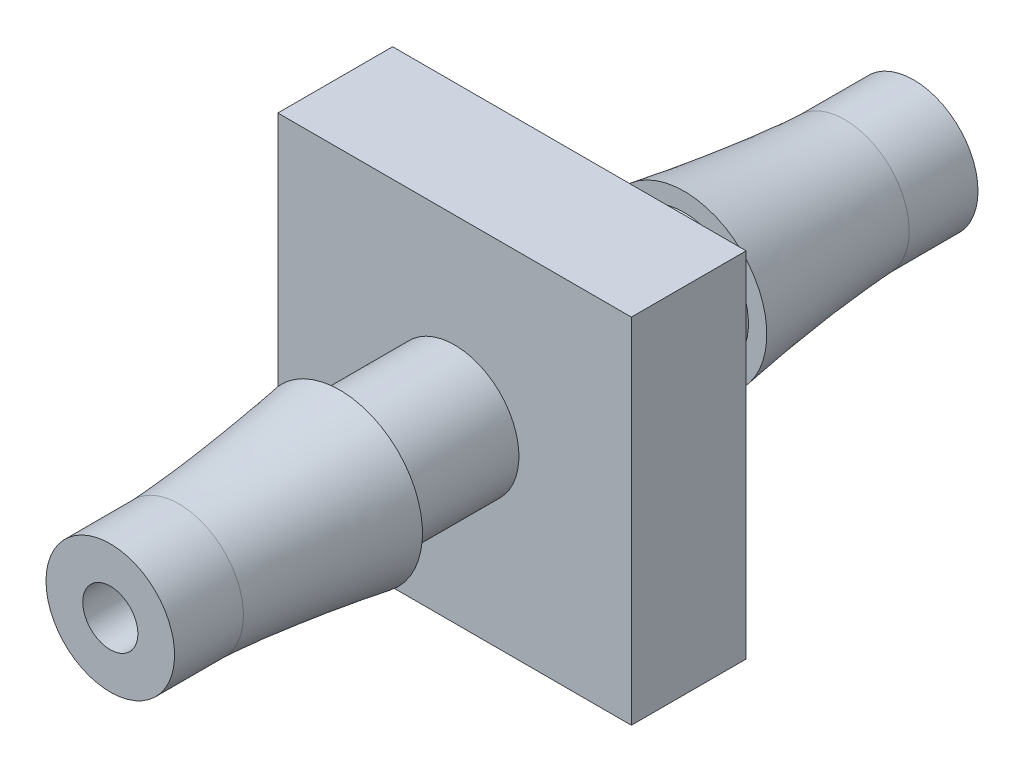
from build123d import *

# Parameters (mm, degrees)
CROQUIS1_W              = 7.7
CROQUIS1_H              = 7.7
SALIENTE_EXTRUIR1_DEPTH = 2.5
CROQUIS2_R              = 1.4
SALIENTE_EXTRUIR2_DEPTH = 7.5
CROQUIS6_R              = 0.6
CORTAR_EXTRUIR1_DEPTH   = 19.327438542


with BuildPart() as part:
    # Croquis1 → Saliente-Extruir1 (new body)
    with BuildSketch(Plane.XY):
        Rectangle(CROQUIS1_W, CROQUIS1_H)
    extrude(amount=SALIENTE_EXTRUIR1_DEPTH)

    # Croquis2 → Saliente-Extruir2 (add)
    with BuildSketch(Plane(origin=(0, 0, 0), x_dir=(-1, 0, 0), z_dir=(0, 0, -1))):
        Circle(CROQUIS2_R)
    saliente_extruir2 = extrude(amount=SALIENTE_EXTRUIR2_DEPTH)

    # Recubrir2: read off the stored shape, not the designer's step
    # Recubrir2: loft between two sections, ruled curve by curve
    recubrir2_from = [
        Edge.make_bspline([(-0.33839724, 1.767904779, -2.5), (3.197412318, 2.44469926, -2.5), (3.874206798, -1.091110298, -2.5), (0.33839724, -1.767904779, -2.5), (-3.197412318, -2.44469926, -2.5), (-3.874206798, 1.091110298, -2.5), (-0.33839724, 1.767904779, -2.5)], [0, 0, 0, 0, 0.5, 0.5, 0.5, 1, 1, 1, 1], 3, [1, 0.333333333, 0.333333333, 1, 0.333333333, 0.333333333, 1]),
    ]
    recubrir2_to = [
        Edge.make_bspline([(-0.867767345, 1.09862634, -6), (1.329485334, 2.83416103, -6), (3.065020025, 0.636908351, -6), (0.867767345, -1.09862634, -6), (-1.329485334, -2.83416103, -6), (-3.065020025, -0.636908351, -6), (-0.867767345, 1.09862634, -6)], [0, 0, 0, 0, 0.5, 0.5, 0.5, 1, 1, 1, 1], 3, [1, 0.333333333, 0.333333333, 1, 0.333333333, 0.333333333, 1]),
    ]
    recubrir2 = Solid(Shell([*[Face.make_surface_from_curves(recubrir2_from[k], recubrir2_to[k]) for k in range(1)], Face(Wire(recubrir2_from)), Face(Wire(recubrir2_to))]))
    add(recubrir2)

    # Simetría2: Saliente-Extruir2, Recubrir2 across plane
    add(saliente_extruir2.mirror(Plane(origin=(0, 0, 1.25), x_dir=(1, 0, 0), z_dir=(0, 0, -1))))
    add(recubrir2.mirror(Plane(origin=(0, 0, 1.25), x_dir=(1, 0, 0), z_dir=(0, 0, -1))))

    # Croquis6 → Cortar-Extruir1 (cut, through all)
    with BuildSketch(Plane(origin=(0, 0, -7.5), x_dir=(-1, 0, 0), z_dir=(0, 0, -1))):
        Circle(CROQUIS6_R)
    extrude(amount=-CORTAR_EXTRUIR1_DEPTH, mode=Mode.SUBTRACT)


solid = part.part
